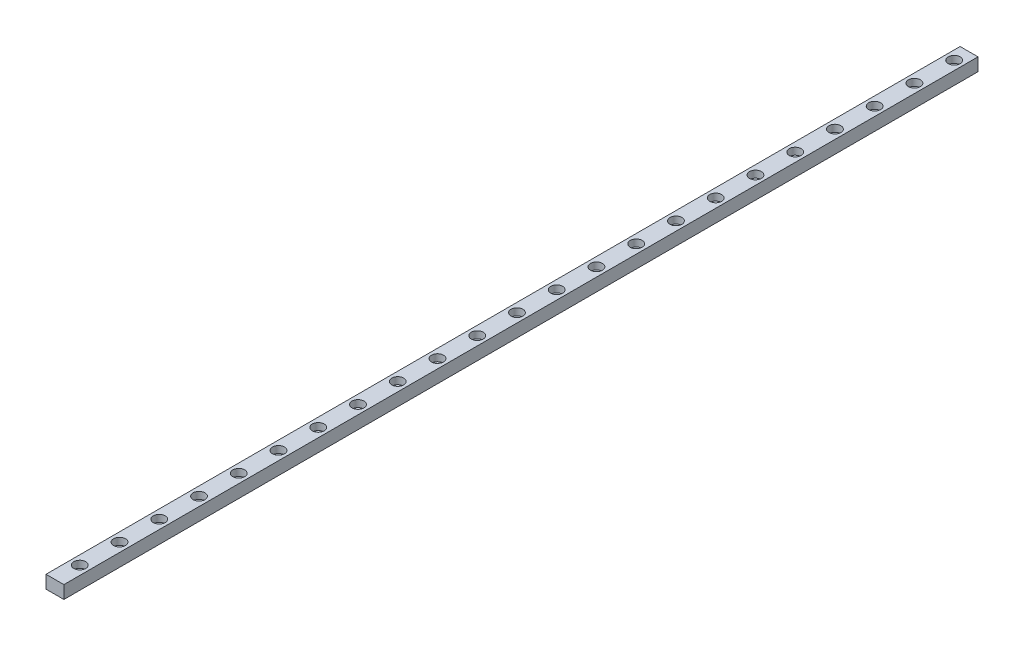
from build123d import *

# Parameters (mm, degrees)
SKETCH_1_W          = 9
SKETCH_1_H          = 6.5
EXTRUDE_1_DEPTH     = 460
SKETCH_2_R          = 1.750000006
CUT_EXTRUDE_1_DEPTH = 371.819449874
SKETCH_3_R          = 3.000000006
CUT_EXTRUDE_2_DEPTH = 3.5


with BuildPart() as part:
    # 草图1 → 凸台-拉伸1 (new body)
    with BuildSketch(Plane.XY.offset(-89.264832522)):
        Rectangle(SKETCH_1_W, SKETCH_1_H)
    extrude(amount=EXTRUDE_1_DEPTH)

    # 草图2 → 切除-拉伸1 (cut, through all)
    with BuildSketch(Plane(origin=(0, 3.25, 0), x_dir=(1, 0, 0), z_dir=(0, 1, 0))):
        with Locations((0, 81.764832522)):
            Circle(SKETCH_2_R)
        with Locations((0, 61.764832522)):
            Circle(SKETCH_2_R)
        with Locations((0, 41.764832522)):
            Circle(SKETCH_2_R)
        with Locations((0, 21.764832522)):
            Circle(SKETCH_2_R)
        with Locations((0, 1.764832522)):
            Circle(SKETCH_2_R)
        with Locations((0, -18.235167478)):
            Circle(SKETCH_2_R)
        with Locations((0, -38.235167478)):
            Circle(SKETCH_2_R)
        with Locations((0, -58.235167478)):
            Circle(SKETCH_2_R)
        with Locations((0, -78.235167478)):
            Circle(SKETCH_2_R)
        with Locations((0, -98.235167478)):
            Circle(SKETCH_2_R)
        with Locations((0, -118.235167478)):
            Circle(SKETCH_2_R)
        with Locations((0, -138.235167478)):
            Circle(SKETCH_2_R)
        with Locations((0, -158.235167478)):
            Circle(SKETCH_2_R)
        with Locations((0, -178.235167478)):
            Circle(SKETCH_2_R)
        with Locations((0, -198.235167478)):
            Circle(SKETCH_2_R)
        with Locations((0, -218.235167478)):
            Circle(SKETCH_2_R)
        with Locations((0, -238.235167478)):
            Circle(SKETCH_2_R)
        with Locations((0, -258.235167478)):
            Circle(SKETCH_2_R)
        with Locations((0, -278.235167478)):
            Circle(SKETCH_2_R)
        with Locations((0, -298.235167478)):
            Circle(SKETCH_2_R)
        with Locations((0, -318.235167478)):
            Circle(SKETCH_2_R)
        with Locations((0, -338.235167478)):
            Circle(SKETCH_2_R)
        with Locations((0, -358.235167478)):
            Circle(SKETCH_2_R)
        with Locations((0, -378.235167478)):
            Circle(SKETCH_2_R)
        with Locations((0, -398.235167478)):
            Circle(SKETCH_2_R)
        with Locations((0, -418.235167478)):
            Circle(SKETCH_2_R)
        with Locations((0, -438.235167478)):
            Circle(SKETCH_2_R)
        with Locations((0, -458.235167478)):
            Circle(SKETCH_2_R)
        with Locations((0, -478.235167478)):
            Circle(SKETCH_2_R)
        with Locations((0, -498.235167478)):
            Circle(SKETCH_2_R)
        with Locations((0, -518.235167478)):
            Circle(SKETCH_2_R)
        with Locations((0, -538.235167478)):
            Circle(SKETCH_2_R)
        with Locations((0, -558.235167478)):
            Circle(SKETCH_2_R)
        with Locations((0, -578.235167478)):
            Circle(SKETCH_2_R)
        with Locations((0, -598.235167478)):
            Circle(SKETCH_2_R)
        with Locations((0, -618.235167478)):
            Circle(SKETCH_2_R)
        with Locations((0, -638.235167478)):
            Circle(SKETCH_2_R)
        with Locations((0, -658.235167478)):
            Circle(SKETCH_2_R)
        with Locations((0, -678.235167478)):
            Circle(SKETCH_2_R)
        with Locations((0, -698.235167478)):
            Circle(SKETCH_2_R)
        with Locations((0, -718.235167478)):
            Circle(SKETCH_2_R)
        with Locations((0, -738.235167478)):
            Circle(SKETCH_2_R)
        with Locations((0, -758.235167478)):
            Circle(SKETCH_2_R)
        with Locations((0, -778.235167478)):
            Circle(SKETCH_2_R)
        with Locations((0, -798.235167478)):
            Circle(SKETCH_2_R)
        with Locations((0, -818.235167478)):
            Circle(SKETCH_2_R)
        with Locations((0, -838.235167478)):
            Circle(SKETCH_2_R)
        with Locations((0, -858.235167478)):
            Circle(SKETCH_2_R)
        with Locations((0, -878.235167478)):
            Circle(SKETCH_2_R)
        with Locations((0, -898.235167478)):
            Circle(SKETCH_2_R)
        with Locations((0, -918.235167478)):
            Circle(SKETCH_2_R)
        with Locations((0, -938.235167478)):
            Circle(SKETCH_2_R)
        with Locations((0, -958.235167478)):
            Circle(SKETCH_2_R)
        with Locations((0, -978.235167478)):
            Circle(SKETCH_2_R)
        with Locations((0, -998.235167478)):
            Circle(SKETCH_2_R)
        with Locations((0, -1018.235167478)):
            Circle(SKETCH_2_R)
        with Locations((0, -1038.235167478)):
            Circle(SKETCH_2_R)
        with Locations((0, -1058.235167478)):
            Circle(SKETCH_2_R)
        with Locations((0, -1078.235167478)):
            Circle(SKETCH_2_R)
        with Locations((0, -1098.235167478)):
            Circle(SKETCH_2_R)
    extrude(amount=-CUT_EXTRUDE_1_DEPTH, mode=Mode.SUBTRACT)

    # 草图3 → 切除-拉伸2 (cut)
    with BuildSketch(Plane(origin=(0, 3.25, 0), x_dir=(1, 0, 0), z_dir=(0, 1, 0))):
        with Locations((0, 81.764832522)):
            Circle(SKETCH_3_R)
        with Locations((0, 61.764832522)):
            Circle(SKETCH_3_R)
        with Locations((0, 41.764832522)):
            Circle(SKETCH_3_R)
        with Locations((0, 21.764832522)):
            Circle(SKETCH_3_R)
        with Locations((0, 1.764832522)):
            Circle(SKETCH_3_R)
        with Locations((0, -18.235167478)):
            Circle(SKETCH_3_R)
        with Locations((0, -38.235167478)):
            Circle(SKETCH_3_R)
        with Locations((0, -58.235167478)):
            Circle(SKETCH_3_R)
        with Locations((0, -78.235167478)):
            Circle(SKETCH_3_R)
        with Locations((0, -98.235167478)):
            Circle(SKETCH_3_R)
        with Locations((0, -118.235167478)):
            Circle(SKETCH_3_R)
        with Locations((0, -138.235167478)):
            Circle(SKETCH_3_R)
        with Locations((0, -158.235167478)):
            Circle(SKETCH_3_R)
        with Locations((0, -178.235167478)):
            Circle(SKETCH_3_R)
        with Locations((0, -198.235167478)):
            Circle(SKETCH_3_R)
        with Locations((0, -218.235167478)):
            Circle(SKETCH_3_R)
        with Locations((0, -238.235167478)):
            Circle(SKETCH_3_R)
        with Locations((0, -258.235167478)):
            Circle(SKETCH_3_R)
        with Locations((0, -278.235167478)):
            Circle(SKETCH_3_R)
        with Locations((0, -298.235167478)):
            Circle(SKETCH_3_R)
        with Locations((0, -318.235167478)):
            Circle(SKETCH_3_R)
        with Locations((0, -338.235167478)):
            Circle(SKETCH_3_R)
        with Locations((0, -358.235167478)):
            Circle(SKETCH_3_R)
        with Locations((0, -378.235167478)):
            Circle(SKETCH_3_R)
        with Locations((0, -398.235167478)):
            Circle(SKETCH_3_R)
        with Locations((0, -418.235167478)):
            Circle(SKETCH_3_R)
        with Locations((0, -438.235167478)):
            Circle(SKETCH_3_R)
        with Locations((0, -458.235167478)):
            Circle(SKETCH_3_R)
        with Locations((0, -478.235167478)):
            Circle(SKETCH_3_R)
        with Locations((0, -498.235167478)):
            Circle(SKETCH_3_R)
        with Locations((0, -518.235167478)):
            Circle(SKETCH_3_R)
        with Locations((0, -538.235167478)):
            Circle(SKETCH_3_R)
        with Locations((0, -558.235167478)):
            Circle(SKETCH_3_R)
        with Locations((0, -578.235167478)):
            Circle(SKETCH_3_R)
        with Locations((0, -598.235167478)):
            Circle(SKETCH_3_R)
        with Locations((0, -618.235167478)):
            Circle(SKETCH_3_R)
        with Locations((0, -638.235167478)):
            Circle(SKETCH_3_R)
        with Locations((0, -658.235167478)):
            Circle(SKETCH_3_R)
        with Locations((0, -678.235167478)):
            Circle(SKETCH_3_R)
        with Locations((0, -698.235167478)):
            Circle(SKETCH_3_R)
        with Locations((0, -718.235167478)):
            Circle(SKETCH_3_R)
        with Locations((0, -738.235167478)):
            Circle(SKETCH_3_R)
        with Locations((0, -758.235167478)):
            Circle(SKETCH_3_R)
        with Locations((0, -778.235167478)):
            Circle(SKETCH_3_R)
        with Locations((0, -798.235167478)):
            Circle(SKETCH_3_R)
        with Locations((0, -818.235167478)):
            Circle(SKETCH_3_R)
        with Locations((0, -838.235167478)):
            Circle(SKETCH_3_R)
        with Locations((0, -858.235167478)):
            Circle(SKETCH_3_R)
        with Locations((0, -878.235167478)):
            Circle(SKETCH_3_R)
        with Locations((0, -898.235167478)):
            Circle(SKETCH_3_R)
        with Locations((0, -918.235167478)):
            Circle(SKETCH_3_R)
        with Locations((0, -938.235167478)):
            Circle(SKETCH_3_R)
        with Locations((0, -958.235167478)):
            Circle(SKETCH_3_R)
        with Locations((0, -978.235167478)):
            Circle(SKETCH_3_R)
        with Locations((0, -998.235167478)):
            Circle(SKETCH_3_R)
        with Locations((0, -1018.235167478)):
            Circle(SKETCH_3_R)
        with Locations((0, -1038.235167478)):
            Circle(SKETCH_3_R)
        with Locations((0, -1058.235167478)):
            Circle(SKETCH_3_R)
        with Locations((0, -1078.235167478)):
            Circle(SKETCH_3_R)
        with Locations((0, -1098.235167478)):
            Circle(SKETCH_3_R)
    extrude(amount=-CUT_EXTRUDE_2_DEPTH, mode=Mode.SUBTRACT)


solid = part.part
